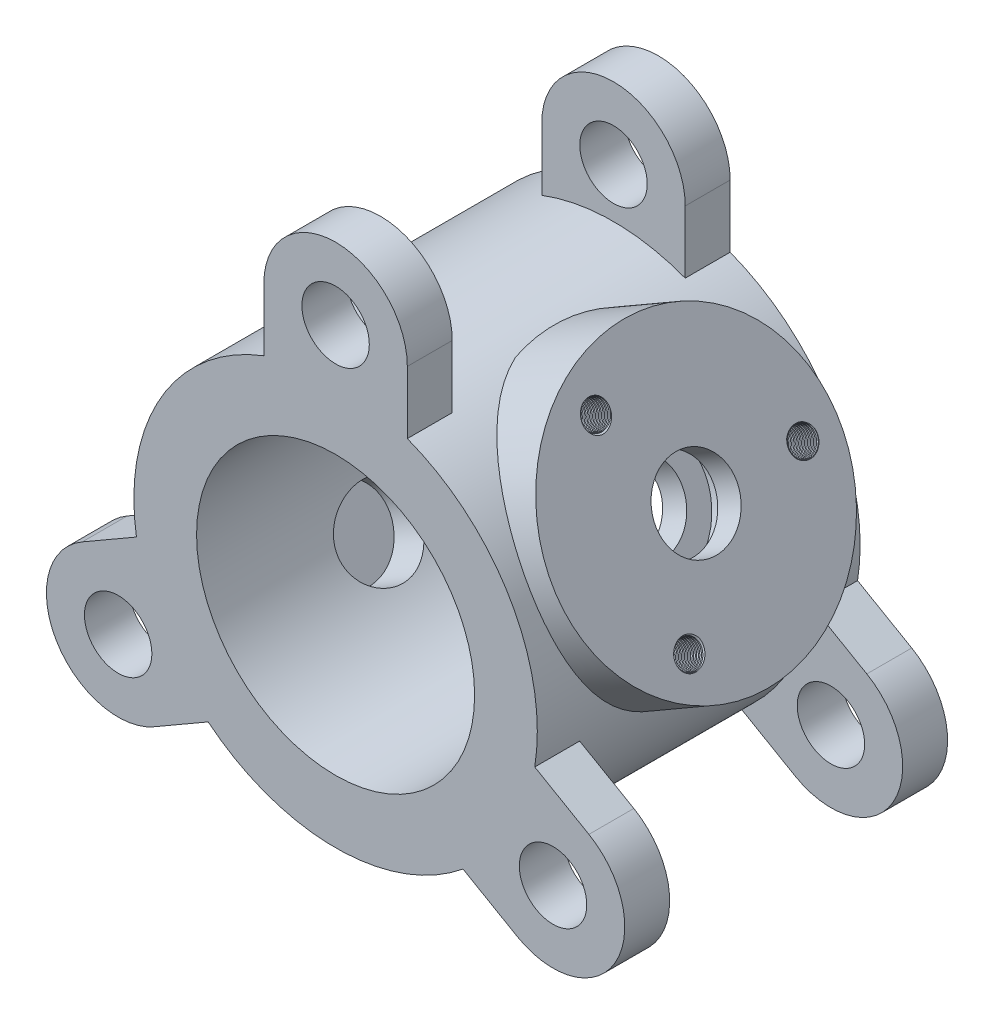
from build123d import *

# Parameters (mm, degrees)
SKETCH1_R                = 35.7124
SKETCH1_R_2              = 24.6126
BOSS_EXTRUDE1_DEPTH      = 28.575
SKETCH1_5_R              = 5.969
BOSS_EXTRUDE3_DEPTH      = 7.9502
BOSS_EXTRUDE5_DEPTH      = 4.7752
BOSS_EXTRUDE5_DEPTH_BACK = 9.525
SKETCH3_R                = 25.4
SKETCH6_R                = 7.1374
BOSS_EXTRUDE6_DEPTH      = 6.35
SKETCH10_R               = 7.1374
CUT_EXTRUDE3_DEPTH       = 71.4502
SKETCH32_R               = 2.413
CUT_EXTRUDE4_DEPTH       = 9.525
CUT_SWEEP2_PITCH         = 0.623272727
CIRPATTERN1_COUNT        = 3


with BuildPart() as part:
    # Sketch1 → Boss-Extrude1 (new body)
    with BuildSketch(Plane.XY):
        Circle(SKETCH1_R)
        Circle(SKETCH1_R_2, mode=Mode.SUBTRACT)
    boss_extrude1 = extrude(amount=BOSS_EXTRUDE1_DEPTH)

    # Sketch1<5> → Boss-Extrude3 (add)
    # profile 1 of 3: a face of its own
    with BuildSketch(Plane.XY):
        with BuildLine():
            ThreePointArc((-12.7, 33.377919554), (0, 35.7124), (12.7, 33.377919554))
            Line((12.7, 33.377919554), (12.7, 44.45))
            ThreePointArc((12.7, 44.45), (0, 57.15), (-12.7, 44.45))
            Line((-12.7, 44.45), (-12.7, 33.377919554))
        make_face()
        with Locations((0, 44.45)):
            Circle(SKETCH1_5_R, mode=Mode.SUBTRACT)
    # profile 2 of 3: a face of its own
    with BuildSketch(Plane.XY):
        with BuildLine():
            ThreePointArc((32.144829198, -33.223522628), (49.493351826, -28.575), (44.844829198, -11.226477372))
            Line((44.844829198, -11.226477372), (35.256126259, -5.690437149))
            ThreePointArc((35.256126259, -5.690437149), (30.92784563, -17.8562), (22.556126259, -27.687482405))
            Line((22.556126259, -27.687482405), (32.144829198, -33.223522628))
        make_face()
        with Locations((38.494829198, -22.225)):
            Circle(SKETCH1_5_R, mode=Mode.SUBTRACT)
    # profile 3 of 3: a face of its own
    with BuildSketch(Plane.XY):
        with BuildLine():
            Line((-32.144829198, -33.223522628), (-22.556126259, -27.687482405))
            ThreePointArc((-22.556126259, -27.687482405), (-30.92784563, -17.8562), (-35.256126259, -5.690437149))
            Line((-35.256126259, -5.690437149), (-44.844829198, -11.226477372))
            ThreePointArc((-44.844829198, -11.226477372), (-49.493351826, -28.575), (-32.144829198, -33.223522628))
        make_face()
        with Locations((-38.494829198, -22.225)):
            Circle(SKETCH1_5_R, mode=Mode.SUBTRACT)
    boss_extrude3 = extrude(amount=BOSS_EXTRUDE3_DEPTH)

    # Mirror1: Boss-Extrude1, Boss-Extrude3 across plane
    add(boss_extrude1.mirror(Plane.XY.offset(28.575)))
    add(boss_extrude3.mirror(Plane.XY.offset(28.575)))

    # Sketch3 → Boss-Extrude5 (add, two sides: drawn at the far end of the back side and taken through both)
    with BuildSketch(Plane(origin=(30.92784563, 17.8562, 0), x_dir=(0, 0, -1), z_dir=(0.8660254037844384, 0.5000000000000003, 0)).offset(-BOSS_EXTRUDE5_DEPTH_BACK)):
        with Locations(Location((-28.39232337, 0, 0), (0, 0, 252.934149522))):
            Circle(SKETCH3_R)
    extrude(amount=BOSS_EXTRUDE5_DEPTH + BOSS_EXTRUDE5_DEPTH_BACK)

    # Sketch10 → Cut-Extrude3 (cut)
    with BuildSketch(Plane(origin=(35.503231043, 20.4978, 0), x_dir=(0, 0, -1), z_dir=(0.8660254037844385, 0.5000000000000006, 0))):
        with Locations(Location((-28.39232337, 0, 0), (0, 0, 90))):
            Circle(SKETCH10_R)
    extrude(amount=-CUT_EXTRUDE3_DEPTH, mode=Mode.SUBTRACT)

    # Sketch26 → CBORE for #10 Binding Head Machine Screw1 (revolve, cut)
    with BuildSketch(Plane(origin=(30.92784563, 17.8562, 28.39232337), x_dir=(-0.5000000000000004, 0.8660254037844385, 0), z_dir=(0, 0, 1))):
        Polygon((0, 0), (0, 53.603816902), (2.5527, 52.07), (2.5527, 6.35), (11.1125, 6.35), (11.1125, 0), align=None)
    revolve(axis=Axis((36.427106944, 21.0312, 28.39232337), (-0.8660254037844385, -0.5000000000000004, 0)), mode=Mode.SUBTRACT)

    # Sketch32 → Cut-Extrude4 (cut)
    with BuildSketch(Plane(origin=(35.503231043, 20.4978, 0), x_dir=(0, 0, -1), z_dir=(0.8660254037844385, 0.5000000000000006, 0))):
        with Locations(Location((-9.34232337, 0, 0), (0, 0, 90))):
            Circle(SKETCH32_R)
    cut_extrude4 = extrude(amount=-CUT_EXTRUDE4_DEPTH, mode=Mode.SUBTRACT)

    # Cut-Sweep2: arcs per turn and ends read off the stored shape
    # Cut-Sweep2: the profile of Sketch36 screwed along a right-hand helix through 15.25 turns, 6 arcs to a turn; built about Z, then put on its axis
    cut_sweep2_z = Axis((0, 0, 0), (0, 0, 1))
    cut_sweep2_corners = [(2.703068661, 0.000591753, -0.014747776), (2.363978383, 0.008440848, -0.210364231), (2.363978383, -0.007257341, 0.180868678)]
    with BuildLine(mode=Mode.PRIVATE) as cut_sweep2_profile:
        Line(cut_sweep2_corners[0], cut_sweep2_corners[1])
        Line(cut_sweep2_corners[1], cut_sweep2_corners[2])
        Line(cut_sweep2_corners[2], cut_sweep2_corners[0])
    cut_sweep2_cap = Face(cut_sweep2_profile.wire())
    cut_sweep2_turn_angles = [0, 30, 60, 90, 120, 150, 180, 210, 240, 270, 300, 330, 360]
    cut_sweep2_turn_weights = [1, 0.8660254037844387, 1, 0.8660254037844387, 1, 0.8660254037844387, 1, 0.8660254037844387, 1, 0.8660254037844387, 1, 0.8660254037844387, 1]
    cut_sweep2_turn_rails = [Edge.make_bspline([Vector(p[0], p[1], 0).rotate(cut_sweep2_z, cut_sweep2_turn_angles[k]) / cut_sweep2_turn_weights[k] + Vector(0, 0, p[2] + CUT_SWEEP2_PITCH * cut_sweep2_turn_angles[k] / 360) for k in range(13)], [0, 0, 0, 1, 1, 2, 2, 3, 3, 4, 4, 5, 5, 6, 6, 6], 2, cut_sweep2_turn_weights) for p in cut_sweep2_corners]
    cut_sweep2_turn_sides = [Face.make_surface_from_curves(cut_sweep2_turn_rails[p[0]], cut_sweep2_turn_rails[p[1]]) for p in [(0, 1), (1, 2), (2, 0)]]
    cut_sweep2_last_angles = [5400, 5430, 5460, 5475, 5490]
    cut_sweep2_last_weights = [1, 0.8660254037844387, 1, 0.9659258262889738, 1]
    cut_sweep2_last_rails = [Edge.make_bspline([Vector(p[0], p[1], 0).rotate(cut_sweep2_z, cut_sweep2_last_angles[k]) / cut_sweep2_last_weights[k] + Vector(0, 0, p[2] + CUT_SWEEP2_PITCH * cut_sweep2_last_angles[k] / 360) for k in range(5)], [0, 0, 0, 1, 1, 2, 2, 2], 2, cut_sweep2_last_weights) for p in cut_sweep2_corners]
    cut_sweep2_last_sides = [Face.make_surface_from_curves(cut_sweep2_last_rails[p[0]], cut_sweep2_last_rails[p[1]]) for p in [(0, 1), (1, 2), (2, 0)]]
    cut_sweep2 = Plane(origin=(35.503231043, 20.4978, 9.34232337), x_dir=(-0.5000000000000004, 0.8660254037844385, 0), z_dir=(-0.8660254037844385, -0.5000000000000006, 0)) * Solid(Shell([*[p.moved(Location((0, 0, CUT_SWEEP2_PITCH * i))) for i in range(15) for p in cut_sweep2_turn_sides], *cut_sweep2_last_sides, cut_sweep2_cap, cut_sweep2_cap.rotate(cut_sweep2_z, 5490).moved(Location((0, 0, CUT_SWEEP2_PITCH * 5490 / 360)))]))
    add(cut_sweep2, mode=Mode.SUBTRACT)

    # CirPattern1: Cut-Extrude4, Cut-Sweep2 ×3 about axis
    cirpattern1_axis = Axis((35.063290138, 20.2438, 28.39232337), (0.8660254037844385, 0.5000000000000004, 0))
    add([cut_extrude4.rotate(cirpattern1_axis, i * 360 / CIRPATTERN1_COUNT) for i in range(1, CIRPATTERN1_COUNT)], mode=Mode.SUBTRACT)
    add([cut_sweep2.rotate(cirpattern1_axis, i * 360 / CIRPATTERN1_COUNT) for i in range(1, CIRPATTERN1_COUNT)], mode=Mode.SUBTRACT)


with BuildPart() as body_2:
    # Sketch6 → Boss-Extrude6 (new body)
    with BuildSketch(Plane(origin=(-30.92784563, -17.8562, 0), x_dir=(0, 0, 1), z_dir=(-0.8660254037844384, -0.5000000000000003, 0))):
        with Locations(Location((28.355992676, 0, 0), (0, 0, 270))):
            Circle(SKETCH6_R)
    extrude(amount=BOSS_EXTRUDE6_DEPTH)


solid = Compound([part.part, body_2.part])
